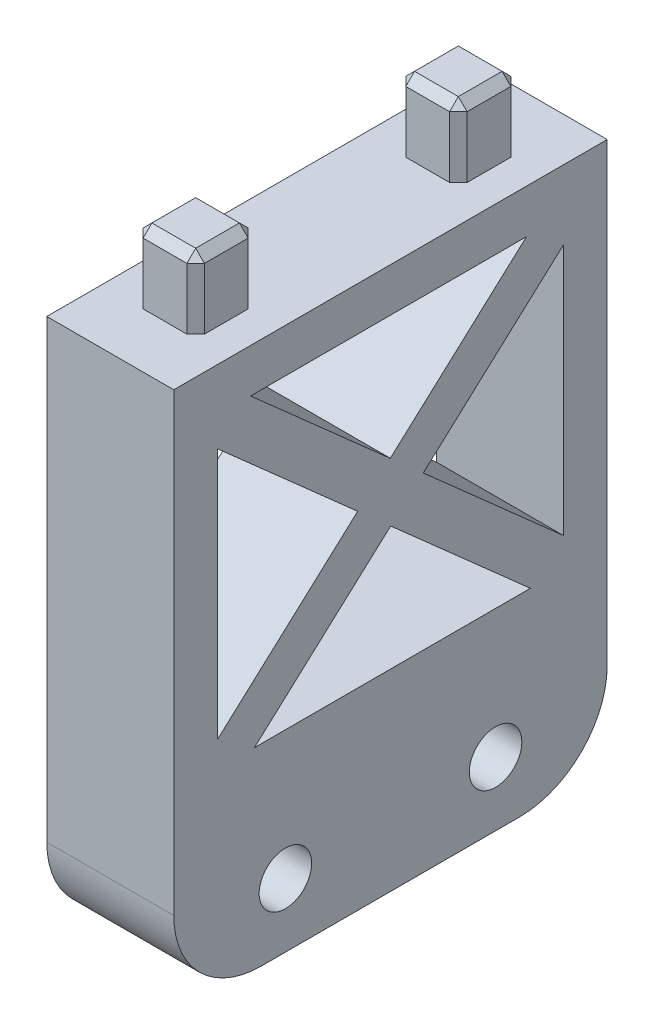
from build123d import *

# Parameters (mm, degrees)
SKETCH1_W           = 14.5
SKETCH1_H           = 49.5
BOSS_EXTRUDE1_DEPTH = 70
FILLET1_R           = 10
SKETCH2_R           = 3
CUT_EXTRUDE1_DEPTH  = 76.649272964
BOSS_EXTRUDE2_DEPTH = 8
SKETCH5_R           = 1.7
CUT_EXTRUDE2_DEPTH  = 15
CUT_EXTRUDE3_DEPTH  = 5
CUT_EXTRUDE4_DEPTH  = 103.041964407
CUT_EXTRUDE5_DEPTH  = 10
FILLET2_R           = 1.5
FILLET3_R           = 3
SKETCH11_R          = 1.7
CUT_EXTRUDE7_DEPTH  = 3
CUT_EXTRUDE8_DEPTH  = 116.402827088
SKETCH13_W          = 14.5
SKETCH13_H          = 49.5
SKETCH13_W_2        = 7
SKETCH13_H_2        = 7
CUT_EXTRUDE9_DEPTH  = 8
CHAMFER1_SIZE       = 1


with BuildPart() as part:
    # Sketch1 → Boss-Extrude1 (new body)
    with BuildSketch(Plane(origin=(0, 0, 0), x_dir=(1, 0, 0), z_dir=(0, 1, 0))):
        Rectangle(SKETCH1_W, SKETCH1_H)
    extrude(amount=BOSS_EXTRUDE1_DEPTH)

    # Fillet1
    fillet1_edges = [part.edges().sort_by_distance(p)[0] for p in [
        (0, 0, -24.75),
        (0, 0, 24.75),
    ]]
    fillet(fillet1_edges, radius=FILLET1_R)

    # Sketch2 → Cut-Extrude1 (cut, through all)
    with BuildSketch(Plane(origin=(7.25, 0, 0), x_dir=(0, 0, -1), z_dir=(1, 0, 0))):
        with Locations((-12, 7.3)):
            Circle(SKETCH2_R)
        with Locations((12, 7.3)):
            Circle(SKETCH2_R)
    extrude(amount=-CUT_EXTRUDE1_DEPTH, mode=Mode.SUBTRACT)

    # Sketch3 → Boss-Extrude2 (add)
    with BuildSketch(Plane(origin=(0, 70, 0), x_dir=(1, 0, 0), z_dir=(0, 1, 0))):
        Polygon((77.25, 8.5), (77.25, -8.5), (7.25, -24.75), (7.25, 24.75), align=None)
    extrude(amount=-BOSS_EXTRUDE2_DEPTH)

    # Sketch5 → Cut-Extrude2 (cut)
    with BuildSketch(Plane(origin=(77.25, 0, 0), x_dir=(0, 0, -1), z_dir=(1, 0, 0))):
        with Locations((-4.25, 66)):
            Circle(SKETCH5_R)
        with Locations((4.25, 66)):
            Circle(SKETCH5_R)
    extrude(amount=-CUT_EXTRUDE2_DEPTH, mode=Mode.SUBTRACT)

    # Sketch7 → Cut-Extrude3 (cut)
    with BuildSketch(Plane(origin=(62.25, 0, 0), x_dir=(0, 0, -1), z_dir=(1, 0, 0))):
        Polygon((-7.5, 66), (-7.5, 70), (-1, 70), (-1, 66), (-2.625, 63.185417438), (-5.875, 63.185417438), align=None)
        Polygon((1, 66), (2.625, 63.185417438), (5.875, 63.185417438), (7.5, 66), (7.5, 70), (1, 70), align=None)
    extrude(amount=CUT_EXTRUDE3_DEPTH, mode=Mode.SUBTRACT)

    # Sketch8 → Cut-Extrude4 (cut, through all)
    with BuildSketch(Plane(origin=(7.25, 0, 0), x_dir=(0, 0, -1), z_dir=(1, 0, 0))):
        Polygon((0.021408878, 36.140810628), (15.98032373, 22), (-15.533482813, 22), align=None)
        Polygon((-19.75, 24.924106533), (-19.75, 53.65978052), (-3.742755965, 39.476146565), align=None)
        Polygon((-15.98032373, 57), (15.533482813, 57), (-0.021408878, 42.859189372), align=None)
        Polygon((19.75, 25.34021948), (19.75, 54.075893467), (3.742755965, 39.523853435), align=None)
    extrude(amount=-CUT_EXTRUDE4_DEPTH, mode=Mode.SUBTRACT)

    # Sketch9 → Cut-Extrude5 (cut)
    with BuildSketch(Plane(origin=(0, 70, 0), x_dir=(1, 0, 0), z_dir=(0, 1, 0))):
        Polygon((38.972216713, 2.430662399), (49.616038971, 9.782068685), (17.550981037, 17.225742848), align=None)
        Polygon((35.452952842, 0), (12.25, 16.025665333), (12.25, -16.025665333), align=None)
        Polygon((38.972216713, -2.430662399), (17.550981037, -17.225742848), (49.616038971, -9.782068685), align=None)
        Polygon((57.25, -10.193318694), (57.25, 10.193318694), (42.491480584, 0), align=None)
    extrude(amount=-CUT_EXTRUDE5_DEPTH, mode=Mode.SUBTRACT)

    # Fillet2
    fillet2_edges = [part.edges().sort_by_distance(p)[0] for p in [
        (57.25, 66, 10.193318694),
        (57.25, 66, -10.193318694),
    ]]
    fillet(fillet2_edges, radius=FILLET2_R)

    # Fillet3
    fillet3_edges = [part.edges().sort_by_distance(p)[0] for p in [
        (7.25, 62, 0),
    ]]
    fillet(fillet3_edges, radius=FILLET3_R)

    # Sketch11 → Cut-Extrude7 (cut)
    with BuildSketch(Plane(origin=(62.25, 0, 0), x_dir=(0, 0, -1), z_dir=(1, 0, 0))):
        with Locations((4.25, 66)):
            Circle(SKETCH11_R)
        with Locations((-4.25, 66)):
            Circle(SKETCH11_R)
    extrude(amount=-CUT_EXTRUDE7_DEPTH, mode=Mode.SUBTRACT)

    # Sketch12 → Cut-Extrude8 (cut, through all)
    with BuildSketch(Plane(origin=(0, 0, -24.75), x_dir=(-1, 0, 0), z_dir=(0, 0, -1))):
        with BuildLine():
            Line((-7.25, 70), (-77.25, 70))
            Line((-77.25, 70), (-77.25, 62))
            Line((-77.25, 62), (-10.25, 62))
            ThreePointArc((-10.25, 62), (-8.128679656, 61.121320344), (-7.25, 59))
            Line((-7.25, 59), (-7.25, 70))
        make_face()
    extrude(amount=-CUT_EXTRUDE8_DEPTH, mode=Mode.SUBTRACT)

    # Sketch13 → Cut-Extrude9 (cut)
    with BuildSketch(Plane(origin=(0, 70, 0), x_dir=(1, 0, 0), z_dir=(0, 1, 0))):
        Rectangle(SKETCH13_W, SKETCH13_H)
        with Locations((0, 15)):
            Rectangle(SKETCH13_W_2, SKETCH13_H_2, mode=Mode.SUBTRACT)
        with Locations((0, -15)):
            Rectangle(SKETCH13_W_2, SKETCH13_H_2, mode=Mode.SUBTRACT)
    extrude(amount=-CUT_EXTRUDE9_DEPTH, mode=Mode.SUBTRACT)

    # Chamfer1
    chamfer1_edges = [part.edges().sort_by_distance(p)[0] for p in [
        (0, 70, -11.5),
        (-3.5, 66, -11.5),
        (-3.5, 70, -15),
        (-3.5, 66, -18.5),
        (0, 70, -18.5),
        (3.5, 66, -18.5),
        (3.5, 70, -15),
        (3.5, 66, -11.5),
        (0, 70, 11.5),
        (-3.5, 66, 11.5),
        (-3.5, 70, 15),
        (-3.5, 66, 18.5),
        (0, 70, 18.5),
        (3.5, 66, 18.5),
        (3.5, 70, 15),
        (3.5, 66, 11.5),
    ]]
    chamfer(chamfer1_edges, length=CHAMFER1_SIZE)


solid = part.part
